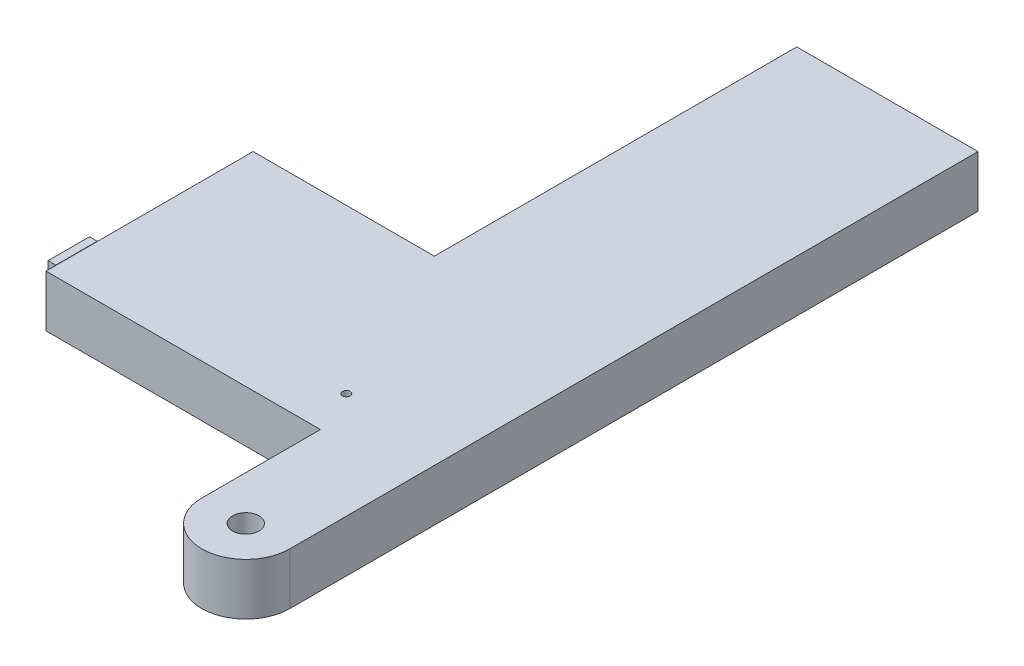
from build123d import *

# Parameters (mm, degrees)
CORNERBOSS_EXTRUDE1_DEPTH               = 20
SHELL1_T                                = -3
PADSKETCH1_R                            = 5
PADSKETCH1_R_2                          = 12
PADBOSS_EXTRUDE1_DEPTH                  = 10
STEPPERSHAFTCUT_SKETCH3_R               = 5.1
STEPPERSHAFTCUT_SKETCH3_R_2             = 1.5
STEPPERSHAFTCUT_EXTRUDE1_DEPTH          = 262.09193783
THREADEDNUTMOUNTHOLESSKETCH5_R          = 1
THREADEDNUTMOUNTHOLESCUT_EXTRUDE2_DEPTH = 10
TOPPEGHOLESKETCH4_W                     = 10
TOPPEGHOLESKETCH4_H                     = 14
TOPPEGHOLECUT_EXTRUDE2_DEPTH            = 3
BLPEGSKETCH5_W                          = 9.8
BLPEGSKETCH5_H                          = 13.9
BLPEGBOSS_EXTRUDE3_DEPTH                = 3.1
BLPEGCAPSKETCH6_W                       = 16
BLPEGCAPSKETCH6_H                       = 17
BLPEGCAPBOSS_EXTRUDE4_DEPTH             = 3
BEDCENTERPEGHOLECUTSKETCH1_W            = 10
BEDCENTERPEGHOLECUTSKETCH1_H            = 14
BEDCENTERPEGHOLECUT_EXTRUDE1_DEPTH      = 3


with BuildPart() as part:
    # CornerrSketch1 → CornerBoss-Extrude1 (new body)
    with BuildSketch(Plane(origin=(0, 0, 0), x_dir=(1, 0, 0), z_dir=(0, 1, 0))):
        with BuildLine():
            Line((0, 0), (0, 80))
            Line((0, 80), (70, 80))
            Line((70, 80), (70, 220))
            Line((70, 220), (140, 220))
            Line((140, 220), (140, -45.825))
            ThreePointArc((140, -45.825), (123, -62.825), (106, -45.825))
            Line((106, -45.825), (106, 0))
            Line((106, 0), (0, 0))
        make_face()
    extrude(amount=CORNERBOSS_EXTRUDE1_DEPTH)

    # Shell1
    shell1_openings = [part.faces().sort_by_distance(p)[0] for p in [
        (89.539211683, 0, -80.750143578),
    ]]
    offset(amount=SHELL1_T, openings=shell1_openings, kind=Kind.INTERSECTION)

    # PadSketch1 → PadBoss-Extrude1 (add)
    with BuildSketch(Plane.XZ.offset(-17)):
        with Locations((99, -17)):
            Circle(PADSKETCH1_R)
        with Locations((123, 45.825)):
            Circle(PADSKETCH1_R_2)
    extrude(amount=PADBOSS_EXTRUDE1_DEPTH)

    # StepperShaftCut-Sketch3 → StepperShaftCut-Extrude1 (cut, through all)
    with BuildSketch(Plane.XZ.offset(-7)):
        with Locations((123, 45.825)):
            Circle(STEPPERSHAFTCUT_SKETCH3_R)
        with Locations((99, -17)):
            Circle(STEPPERSHAFTCUT_SKETCH3_R_2)
    extrude(amount=-STEPPERSHAFTCUT_EXTRUDE1_DEPTH, mode=Mode.SUBTRACT)

    # ThreadedNutMountHolesSketch5 → ThreadedNutMountHolesCut-Extrude2 (cut)
    with BuildSketch(Plane.XZ.offset(-7)):
        with Locations((123, 53.825)):
            Circle(THREADEDNUTMOUNTHOLESSKETCH5_R)
        with Locations((131, 45.825)):
            Circle(THREADEDNUTMOUNTHOLESSKETCH5_R)
        with Locations((115, 45.825)):
            Circle(THREADEDNUTMOUNTHOLESSKETCH5_R)
        with Locations((123, 37.825)):
            Circle(THREADEDNUTMOUNTHOLESSKETCH5_R)
    extrude(amount=-THREADEDNUTMOUNTHOLESCUT_EXTRUDE2_DEPTH, mode=Mode.SUBTRACT)

    # TopPegHoleSketch4 → TopPegHoleCut-Extrude2 (cut)
    with BuildSketch(Plane(origin=(0, 0, -220), x_dir=(-1, 0, 0), z_dir=(0, 0, -1))):
        with Locations((-125, 7)):
            Rectangle(TOPPEGHOLESKETCH4_W, TOPPEGHOLESKETCH4_H)
    extrude(amount=-TOPPEGHOLECUT_EXTRUDE2_DEPTH, mode=Mode.SUBTRACT)

    # BLPegSketch5 → BLPegBoss-Extrude3 (add)
    with BuildSketch(Plane.ZY):
        with Locations((-15, 6.95)):
            Rectangle(BLPEGSKETCH5_W, BLPEGSKETCH5_H)
    extrude(amount=BLPEGBOSS_EXTRUDE3_DEPTH)

    # BLPegCapSketch6 → BLPegCapBoss-Extrude4 (add)
    with BuildSketch(Plane.ZY.offset(3.1)):
        with Locations((-14.9, 8.5)):
            Rectangle(BLPEGCAPSKETCH6_W, BLPEGCAPSKETCH6_H)
    extrude(amount=BLPEGCAPBOSS_EXTRUDE4_DEPTH)

    # BedCenterPegHoleCutSketch1 → BedCenterPegHoleCut-Extrude1 (cut)
    with BuildSketch(Plane.ZY.offset(-70)):
        with Locations((-185, 7)):
            Rectangle(BEDCENTERPEGHOLECUTSKETCH1_W, BEDCENTERPEGHOLECUTSKETCH1_H)
    extrude(amount=-BEDCENTERPEGHOLECUT_EXTRUDE1_DEPTH, mode=Mode.SUBTRACT)


solid = part.part
